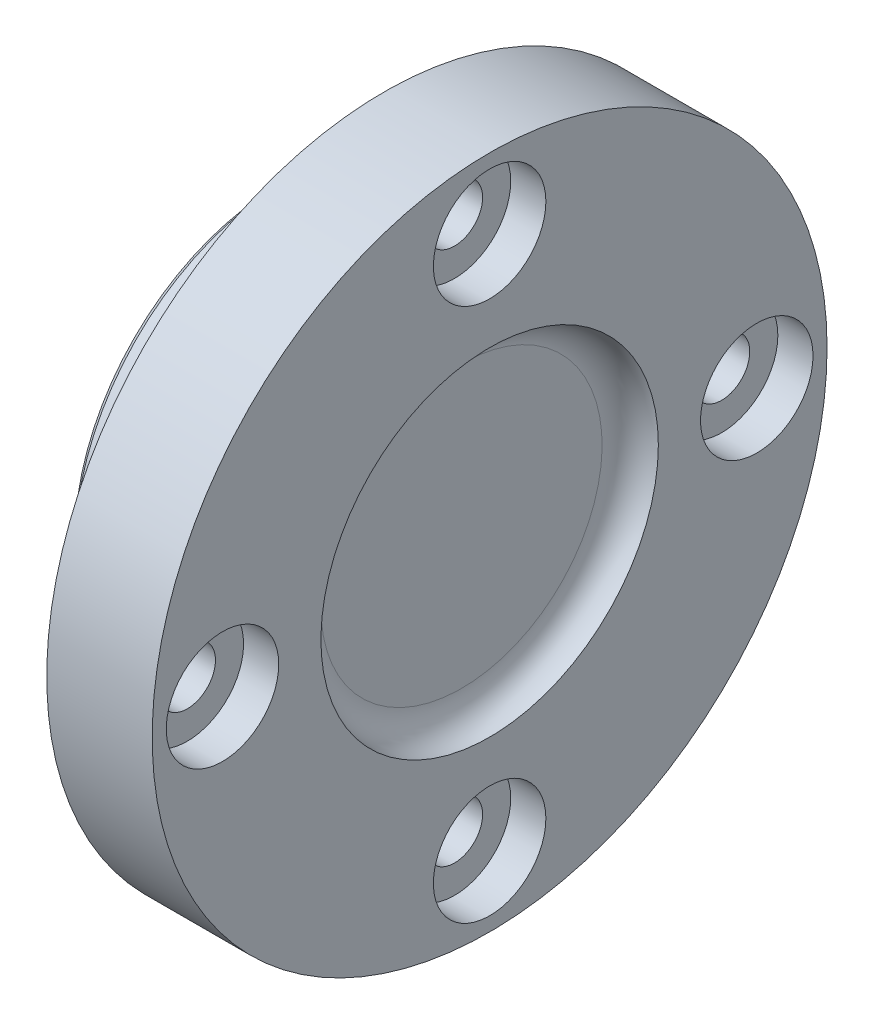
from build123d import *

# Parameters (mm, degrees)
ESQUISSE1_W           = 15
ESQUISSE1_H           = 48
ESQUISSE2_R           = 30
EXTRUSION1_DEPTH      = 15
D_GAGEMENT_M391_D     = 44
D_GAGEMENT_M391_DEPTH = 18
PER_AGE1_D            = 8
PER_AGE1_CBORE_D      = 16
PER_AGE1_CBORE_DEPTH  = 5
PER_AGE2_D            = 8
PER_AGE2_CBORE_D      = 16
PER_AGE2_CBORE_DEPTH  = 5
PER_AGE3_D            = 8
PER_AGE3_CBORE_D      = 16
PER_AGE3_CBORE_DEPTH  = 5
PER_AGE4_D            = 8
PER_AGE4_CBORE_D      = 16
PER_AGE4_CBORE_DEPTH  = 5
CHANFREIN1_SIZE       = 1


# Read off the part's stored shape, not the designer's step: Enlèvement de matière-épaissir1, Enlèvement de matière-épaissir2
with BuildPart() as part:
    # Esquisse1 → Révolution1 (revolve)
    with BuildSketch(Plane.XY, mode=Mode.PRIVATE) as r_volution1_sk:
        with Locations((22.5, 24)):
            Rectangle(ESQUISSE1_W, ESQUISSE1_H)
    revolve(r_volution1_sk.sketch.rotate(Axis((15, 0, 0), (1, 0, 0)), 270), axis=Axis((15, 0, 0), (1, 0, 0)))

    # Esquisse2 → Extrusion1 (add)
    with BuildSketch(Plane.ZY.offset(-15)):
        Circle(ESQUISSE2_R)
    extrude(amount=EXTRUSION1_DEPTH)

    # Dégagement M391
    with Locations(Plane.ZY):
        with Locations((0, 0)):
            Hole(D_GAGEMENT_M391_D / 2, depth=D_GAGEMENT_M391_DEPTH)

    # Enlèvement de matière-épaissir1 outline → Enlèvement de matière-épaissir1 (revolve, cut)
    with BuildSketch(Plane.YX):
        with BuildLine():
            Line((0, 18), (20, 18))
            ThreePointArc((20, 18), (18.828427125, 20.828427125), (16, 22))
            Line((16, 22), (0, 22))
            Line((0, 22), (0, 18))
        make_face()
    revolve(axis=Axis((0, 0, 0), (1, 0, 0)), mode=Mode.SUBTRACT)

    # Enlèvement de matière-épaissir2 outline → Enlèvement de matière-épaissir2 (revolve, cut)
    with BuildSketch(Plane.YX):
        with BuildLine():
            Line((0, 26), (20, 26))
            ThreePointArc((20, 26), (22.828427125, 27.171572875), (24, 30))
            Line((24, 30), (0, 30))
            Line((0, 30), (0, 26))
        make_face()
    revolve(axis=Axis((0, 0, 0), (1, 0, 0)), mode=Mode.SUBTRACT)

    # Perçage1 (through all)
    with Locations(Plane(origin=(30, 0, 0), x_dir=(0, 0, -1), z_dir=(1, 0, 0))):
        with Locations((-38, 0)):
            CounterBoreHole(PER_AGE1_D / 2, PER_AGE1_CBORE_D / 2, PER_AGE1_CBORE_DEPTH)

    # Perçage2 (through all)
    with Locations(Plane(origin=(30, 0, 0), x_dir=(0, 0, -1), z_dir=(1, 0, 0))):
        with Locations((0, -38)):
            CounterBoreHole(PER_AGE2_D / 2, PER_AGE2_CBORE_D / 2, PER_AGE2_CBORE_DEPTH)

    # Perçage3 (through all)
    with Locations(Plane(origin=(30, 0, 0), x_dir=(0, 0, -1), z_dir=(1, 0, 0))):
        with Locations((0, 38)):
            CounterBoreHole(PER_AGE3_D / 2, PER_AGE3_CBORE_D / 2, PER_AGE3_CBORE_DEPTH)

    # Perçage4 (through all)
    with Locations(Plane(origin=(30, 0, 0), x_dir=(0, 0, -1), z_dir=(1, 0, 0))):
        with Locations((38, 0)):
            CounterBoreHole(PER_AGE4_D / 2, PER_AGE4_CBORE_D / 2, PER_AGE4_CBORE_DEPTH)

    # Chanfrein1
    chanfrein1_edges = [part.edges().sort_by_distance(p)[0] for p in [
        (0, 0, 22),
        (0, 0, -30),
    ]]
    chamfer(chanfrein1_edges, length=CHANFREIN1_SIZE)


solid = part.part
